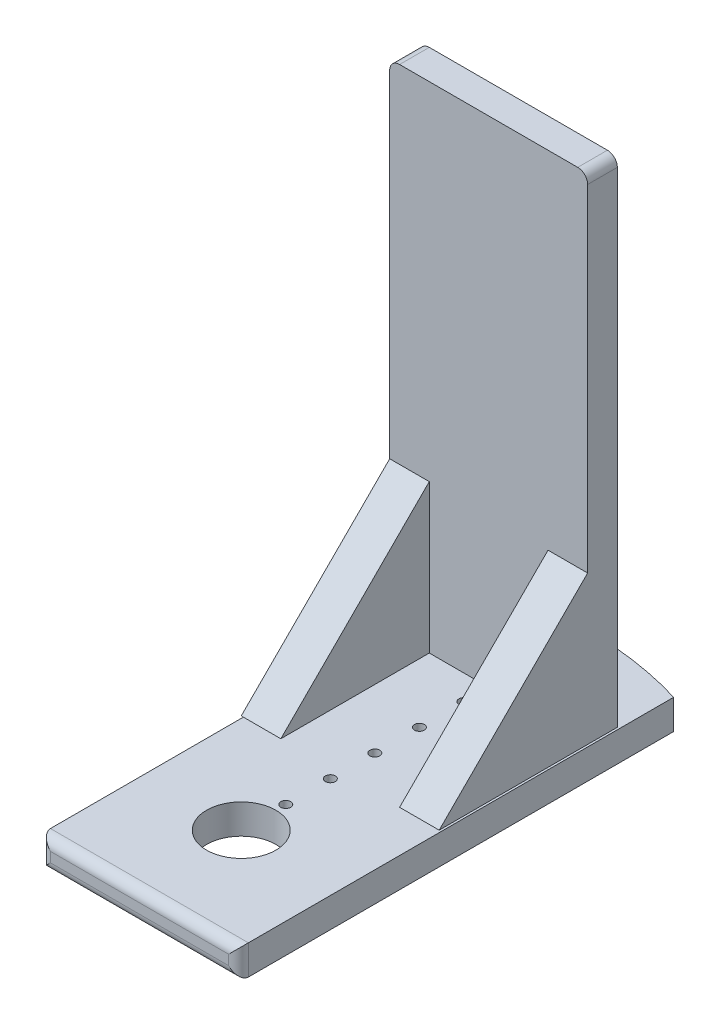
from build123d import *

# Parameters (mm, degrees)
SKETCH_1_R      = 3.5
SKETCH_1_R_2    = 0.5
EXTRUDE_1_DEPTH = 3
SKETCH_3_W      = 20
SKETCH_3_H      = 3
EXTRUDE_2_DEPTH = 50
EXTRUDE_3_DEPTH = 4
EXTRUDE_4_DEPTH = 4
FILLET_2_R      = 1
FILLET_3_R      = 1


with BuildPart() as part:
    # 草图1 → 凸台-拉伸1 (new body)
    with BuildSketch(Plane(origin=(0, 0, 0), x_dir=(1, 0, 0), z_dir=(0, 1, 0))):
        with BuildLine():
            Line((10.216315403, 33.475765855), (10.216315403, -10.494888533))
            Line((10.216315403, -10.494888533), (-9.783684597, -10.494888533))
            Line((-9.783684597, -10.494888533), (-9.783684597, 33.604754362))
            ThreePointArc((-9.783684597, 33.604754362), (0.225725191, 34.999272109), (10.216315403, 33.475765855))
        make_face()
        Circle(SKETCH_1_R, mode=Mode.SUBTRACT)
        with Locations((0, 4.5)):
            Circle(SKETCH_1_R_2, mode=Mode.SUBTRACT)
        with Locations((0, 9)):
            Circle(SKETCH_1_R_2, mode=Mode.SUBTRACT)
        with Locations((0, 13.5)):
            Circle(SKETCH_1_R_2, mode=Mode.SUBTRACT)
        with Locations((0, 18)):
            Circle(SKETCH_1_R_2, mode=Mode.SUBTRACT)
        with Locations((0, 22.5)):
            Circle(SKETCH_1_R_2, mode=Mode.SUBTRACT)
    extrude(amount=EXTRUDE_1_DEPTH)

    # 草图3 → 凸台-拉伸2 (add)
    with BuildSketch(Plane(origin=(0, 3, 0), x_dir=(1, 0, 0), z_dir=(0, 1, 0))):
        with Locations((0, 26.5)):
            Rectangle(SKETCH_3_W, SKETCH_3_H)
    extrude(amount=EXTRUDE_2_DEPTH)

    # 草图5 → 凸台-拉伸3 (add)
    with BuildSketch(Plane.ZY.offset(10)):
        Polygon((-25, 18), (-10, 3), (-25, 3), align=None)
    extrude(amount=-EXTRUDE_3_DEPTH)

    # 草图6 → 凸台-拉伸4 (add)
    with BuildSketch(Plane(origin=(10, 0, -10), x_dir=(0, 0, 1), z_dir=(-1, 0, 0))):
        Polygon((-15, 18), (0, 3), (-15, 3), align=None)
    extrude(amount=EXTRUDE_4_DEPTH)

    # 圆角2
    fillet_2_edges = [part.edges().sort_by_distance(p)[0] for p in [
        (-9.783684597, 1.5, 10.494888533),
        (0.216315403, 3, 10.494888533),
        (10.216315403, 1.5, 10.494888533),
        (0.216315403, 0, 10.494888533),
    ]]
    fillet(fillet_2_edges, radius=FILLET_2_R)

    # 圆角3
    fillet_3_edges = [part.edges().sort_by_distance(p)[0] for p in [
        (10, 53, -26.5),
        (-10, 53, -26.5),
    ]]
    fillet(fillet_3_edges, radius=FILLET_3_R)


solid = part.part
